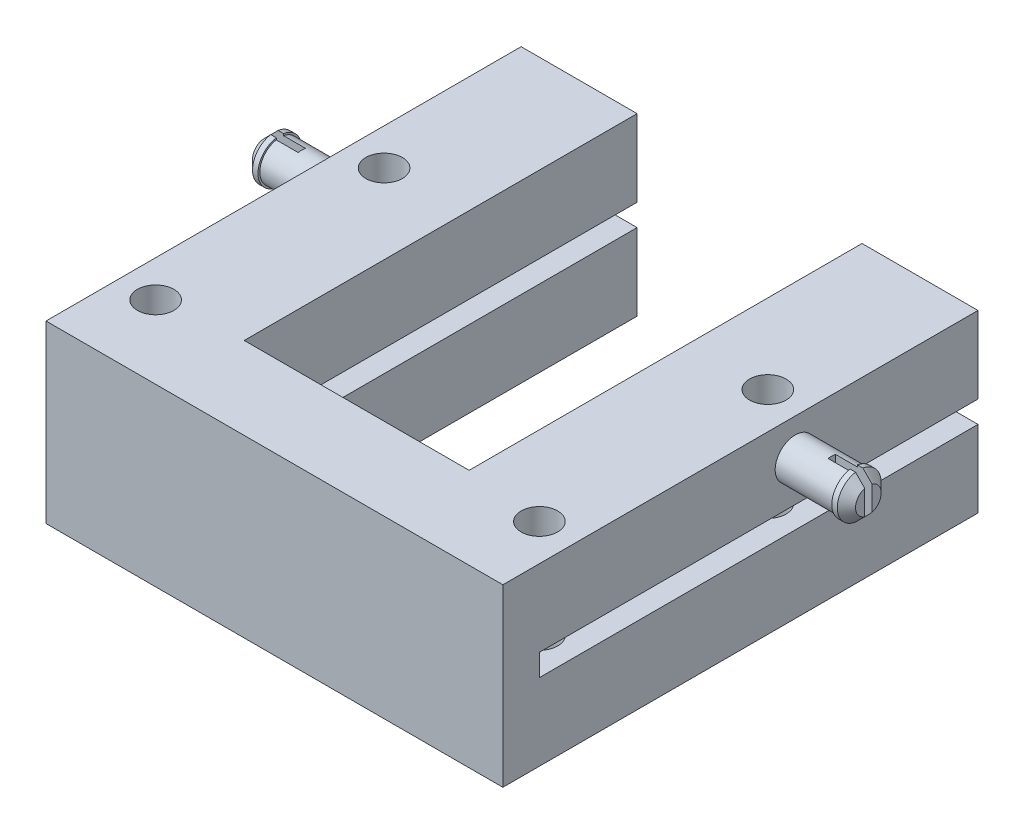
from build123d import *

# Parameters (mm, degrees)
SKETCH1_R           = 1
BOSS_EXTRUDE1_DEPTH = 4.2
SKETCH2_R           = 1.2
BOSS_EXTRUDE2_DEPTH = 4
SKETCH3_W           = 25
SKETCH3_H           = 4.2
BOSS_EXTRUDE3_DEPTH = 2
SKETCH4_W           = 25
SKETCH4_H           = 2
BOSS_EXTRUDE4_DEPTH = 0.6
BOSS_EXTRUDE5_START = -5.4
SKETCH1_3_R         = 1
BOSS_EXTRUDE5_DEPTH = 5.4
SKETCH4_2_W         = 25
SKETCH4_2_H         = 2
BOSS_EXTRUDE6_DEPTH = 5.4
CUT_EXTRUDE2_REACH  = 35.413
SKETCH5_W           = 25
SKETCH5_H           = 1.2
SKETCH6_W           = 2.096367106
SKETCH6_H           = 4.2
BOSS_EXTRUDE8_DEPTH = 21.5
SKETCH5_2_W         = 25
SKETCH5_2_H         = 1.2
CUT_EXTRUDE4_DEPTH  = 2.5
SKETCH8_R           = 1.2
SKETCH8_R_2         = 1.1
CUT_EXTRUDE5_DEPTH  = 3.2
CHAMFER1_SIZE       = 0.5
SKETCH10_W          = 0.4
SKETCH10_H          = 3.208969491
CUT_EXTRUDE6_DEPTH  = 2


# Read off the part's stored shape, not the designer's step: Mirror1
with BuildPart() as part:
    # Sketch1 → Boss-Extrude1 (new body)
    with BuildSketch(Plane(origin=(0, 0, 0), x_dir=(1, 0, 0), z_dir=(0, 1, 0))):
        Polygon((0, 0), (25, 0), (25, 24), (20.75, 24), (20.75, 2.5), (4.25, 2.5), (4.25, 24), (0, 24), align=None)
        with Locations(Location((2, 14.5, 0), (0, 0, 270))):
            Circle(SKETCH1_R, mode=Mode.SUBTRACT)
        with Locations(Location((2, 2, 0), (0, 0, 270))):
            Circle(SKETCH1_R, mode=Mode.SUBTRACT)
        with Locations(Location((23, 2, 0), (0, 0, 90))):
            Circle(SKETCH1_R, mode=Mode.SUBTRACT)
        with Locations(Location((23, 14.5, 0), (0, 0, 90))):
            Circle(SKETCH1_R, mode=Mode.SUBTRACT)
    extrude(amount=BOSS_EXTRUDE1_DEPTH)

    # Sketch2 → Boss-Extrude2 (add)
    with BuildSketch(Plane.ZY):
        with Locations((-14, 2.2)):
            Circle(SKETCH2_R)
    extrude(amount=BOSS_EXTRUDE2_DEPTH)

    # Sketch3 → Boss-Extrude3 (add)
    with BuildSketch(Plane.XY):
        with Locations((12.5, 2.1)):
            Rectangle(SKETCH3_W, SKETCH3_H)
    extrude(amount=BOSS_EXTRUDE3_DEPTH)

    # Sketch4 → Boss-Extrude4 (add)
    with BuildSketch(Plane.XZ):
        with Locations((12.5, 1)):
            Rectangle(SKETCH4_W, SKETCH4_H)
    extrude(amount=BOSS_EXTRUDE4_DEPTH)

    # Sketch1<3> → Boss-Extrude5 (add)
    with BuildSketch(Plane(origin=(0, 0, 0), x_dir=(1, 0, 0), z_dir=(0, 1, 0)).offset(BOSS_EXTRUDE5_START)):
        Polygon((0, 0), (25, 0), (25, 24), (20.75, 24), (20.75, 2.5), (4.25, 2.5), (4.25, 24), (0, 24), align=None)
        with Locations(Location((2, 14.5, 0), (0, 0, 270))):
            Circle(SKETCH1_3_R, mode=Mode.SUBTRACT)
        with Locations(Location((2, 2, 0), (0, 0, 270))):
            Circle(SKETCH1_3_R, mode=Mode.SUBTRACT)
        with Locations(Location((23, 2, 0), (0, 0, 90))):
            Circle(SKETCH1_3_R, mode=Mode.SUBTRACT)
        with Locations(Location((23, 14.5, 0), (0, 0, 90))):
            Circle(SKETCH1_3_R, mode=Mode.SUBTRACT)
    extrude(amount=BOSS_EXTRUDE5_DEPTH)

    # Sketch4<2> → Boss-Extrude6 (add)
    with BuildSketch(Plane.XZ):
        with Locations((12.5, 1)):
            Rectangle(SKETCH4_2_W, SKETCH4_2_H)
    extrude(amount=BOSS_EXTRUDE6_DEPTH)

    # Cut-Extrude2: up to this face of the body (flat: up to its plane)
    cut_extrude2_end = Plane(part.part.faces().sort_by_distance((22.875, -0.6, -24))[0])
    # Sketch5 → Cut-Extrude2 (cut, up to the picked face)
    with BuildSketch(Plane(origin=(0, 0, -2.5), x_dir=(-1, 0, 0), z_dir=(0, 0, -1)), mode=Mode.PRIVATE) as cut_extrude2_sk1:
        with Locations((-12.5, -0.6)):
            Rectangle(SKETCH5_W, SKETCH5_H)
    cut_extrude2_tool1 = split(extrude(cut_extrude2_sk1.sketch, amount=CUT_EXTRUDE2_REACH, mode=Mode.PRIVATE), bisect_by=cut_extrude2_end, keep=Keep.BOTH, mode=Mode.PRIVATE)
    add(cut_extrude2_tool1.solids().sort_by(Axis((12.5, -0.6, -2.5), (0, 0, -1)))[0], mode=Mode.SUBTRACT)

    # Sketch6 → Boss-Extrude8 (add)
    with BuildSketch(Plane(origin=(0, 0, -2.5), x_dir=(-1, 0, 0), z_dir=(0, 0, -1))):
        with Locations((-19.701816447, 2.1)):
            Rectangle(SKETCH6_W, SKETCH6_H)
        with Locations((-5.298183553, 2.1)):
            Rectangle(SKETCH6_W, SKETCH6_H)
        with Locations((-5.298183553, -3.3)):
            Rectangle(SKETCH6_W, SKETCH6_H)
        with Locations((-19.701816447, -3.3)):
            Rectangle(SKETCH6_W, SKETCH6_H)
    extrude(amount=BOSS_EXTRUDE8_DEPTH)

    # Sketch5<2> → Cut-Extrude4 (cut)
    with BuildSketch(Plane(origin=(0, 0, -2.5), x_dir=(-1, 0, 0), z_dir=(0, 0, -1))):
        with Locations((-12.5, -0.6)):
            Rectangle(SKETCH5_2_W, SKETCH5_2_H)
    extrude(amount=-CUT_EXTRUDE4_DEPTH, mode=Mode.SUBTRACT)

    # Sketch8 → Cut-Extrude5 (cut)
    with BuildSketch(Plane.ZY):
        with Locations((-14, 2.2)):
            Circle(SKETCH8_R)
        with Locations((-14, 2.2)):
            Circle(SKETCH8_R_2, mode=Mode.SUBTRACT)
    extrude(amount=CUT_EXTRUDE5_DEPTH, mode=Mode.SUBTRACT)

    # Chamfer1
    chamfer1_edges = [part.edges().sort_by_distance(p)[0] for p in [
        (-4, 2.2, -15.2),
    ]]
    chamfer(chamfer1_edges, length=CHAMFER1_SIZE)

    # Sketch10 → Cut-Extrude6 (cut)
    with BuildSketch(Plane.ZY.offset(4)):
        with Locations((-14, 2.169354983)):
            Rectangle(SKETCH10_W, SKETCH10_H)
    extrude(amount=-CUT_EXTRUDE6_DEPTH, mode=Mode.SUBTRACT)

    # Mirror1: part across plane


with BuildPart() as part_1:
    add(part.part)
    add(part.part.mirror(Plane.ZY.offset(-12.5)))


solid = part_1.part
